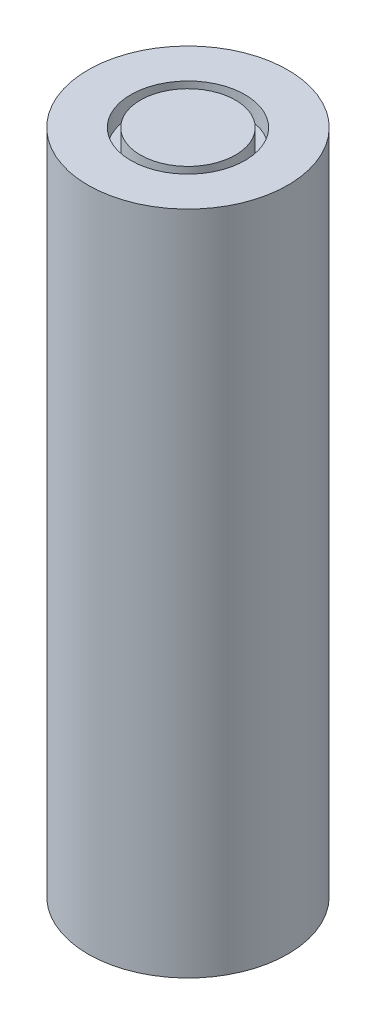
from build123d import *

# Parameters (mm, degrees)
SKETCH1_R           = 10.5
BOSS_EXTRUDE1_DEPTH = 35
SKETCH2_R           = 8.5
BOSS_EXTRUDE2_DEPTH = 0.05
SKETCH3_R           = 6
SKETCH3_R_2         = 5
CUT_EXTRUDE1_DEPTH  = 2


with BuildPart() as part:
    # Sketch1 → Boss-Extrude1 (new, symmetric)
    with BuildSketch(Plane(origin=(0, 0, 0), x_dir=(1, 0, 0), z_dir=(0, 1, 0))):
        Circle(SKETCH1_R)
    extrude(amount=BOSS_EXTRUDE1_DEPTH, both=True)

    # Sketch2 → Boss-Extrude2 (add, symmetric)
    with BuildSketch(Plane.XZ.offset(35)):
        Circle(SKETCH2_R)
    extrude(amount=BOSS_EXTRUDE2_DEPTH, both=True)

    # Sketch3 → Cut-Extrude1 (cut)
    with BuildSketch(Plane(origin=(0, 35, 0), x_dir=(1, 0, 0), z_dir=(0, 1, 0))):
        Circle(SKETCH3_R)
        Circle(SKETCH3_R_2, mode=Mode.SUBTRACT)
    extrude(amount=-CUT_EXTRUDE1_DEPTH, mode=Mode.SUBTRACT)


solid = part.part
